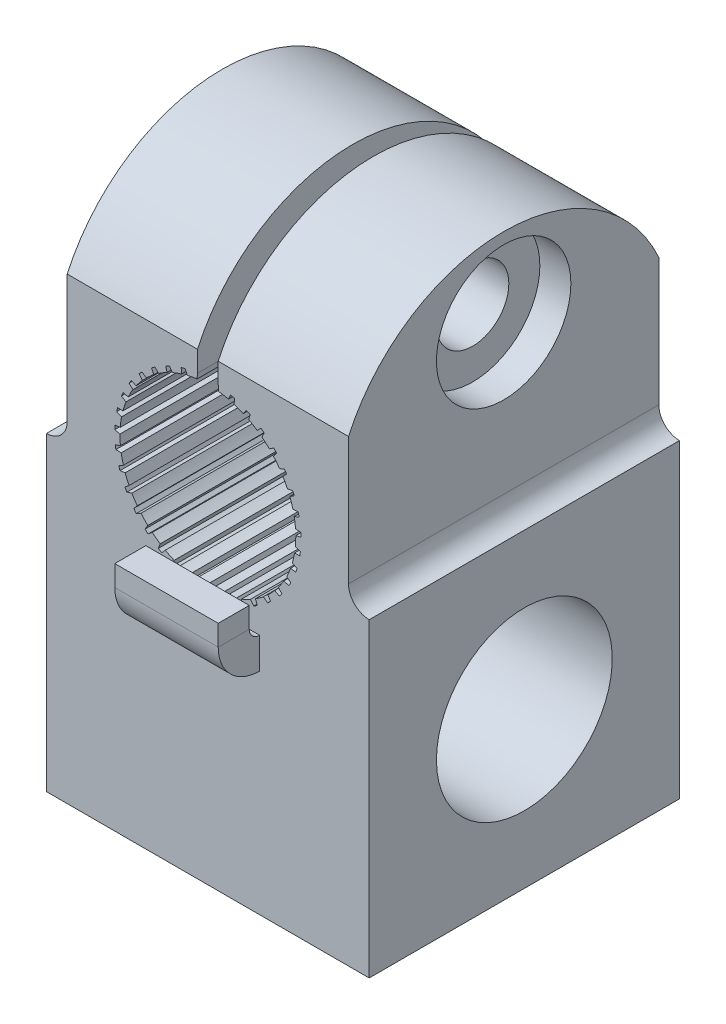
from build123d import *

# Parameters (mm, degrees)
MAIN_BODY_DEPTH     = 7.5
SCREW_DEPTH         = 32.597626493
SCREW_DEPTH_BACK    = 32.597626493
SCHIZZO2_R          = 1.75
SCHIZZO5_R          = 3.25
SCHIZZO5_R_2        = 1.75
WASHER_RECESS_DEPTH = 1.5
NUT_RECESS_DEPTH    = 2.4
CURVE_CUT_DEPTH     = 32.597626493
SCHIZZO7_R          = 4.25
BAR_HOLE_DEPTH      = 33.071950362
RELIEF_1_R          = 1
RELIEF_2_R          = 1
SCHIZZO8_W          = 5
SCHIZZO8_H          = 1.5


with BuildPart() as part:
    # Schizzo1 → Main body (new, symmetric)
    with BuildSketch(Plane.XY):
        with BuildLine():
            Line((-7.8, 0), (-7.8, 15))
            Line((-7.8, 15), (-6.8, 15))
            Line((-6.8, 15), (-6.8, 27))
            Line((-6.8, 27), (-0.5, 27))
            Line((-0.5, 27), (-0.5, 21.172135955))
            Line((-0.5, 21.172135955), (-0.521058877, 20.917937606))
            ThreePointArc((-0.521058877, 20.917937606), (-0.757295619, 20.881985575), (-0.991138348, 20.832813179))
            Line((-0.991138348, 20.832813179), (-1.1, 21.063484846))
            ThreePointArc((-1.1, 21.063484846), (-1.195535928, 21.038282361), (-1.290495504, 21.010988443))
            Line((-1.290495504, 21.010988443), (-1.265827088, 20.757114958))
            ThreePointArc((-1.265827088, 20.757114958), (-1.491847925, 20.679558992), (-1.713152635, 20.589422586))
            Line((-1.713152635, 20.589422586), (-1.861452852, 20.796949265))
            ThreePointArc((-1.861452852, 20.796949265), (-1.950953401, 20.755093196), (-2.03951342, 20.711282215))
            Line((-2.03951342, 20.711282215), (-1.969910575, 20.465893297))
            ThreePointArc((-1.969910575, 20.465893297), (-2.178451011, 20.349226109), (-2.380104787, 20.22102275))
            Line((-2.380104787, 20.22102275), (-2.563077078, 20.398734364))
            ThreePointArc((-2.563077078, 20.398734364), (-2.643665627, 20.341569999), (-2.722979697, 20.282650077))
            Line((-2.722979697, 20.282650077), (-2.610679515, 20.053632728))
            ThreePointArc((-2.610679515, 20.053632728), (-2.795036889, 19.901604096), (-2.970558412, 19.739454346))
            Line((-2.970558412, 19.739454346), (-3.182321897, 19.881639097))
            ThreePointArc((-3.182321897, 19.881639097), (-3.251408264, 19.811003745), (-3.318927165, 19.738868617))
            Line((-3.318927165, 19.738868617), (-3.167539067, 19.533583643))
            ThreePointArc((-3.167539067, 19.533583643), (-3.321787982, 19.351079893), (-3.465535846, 19.160195378))
            Line((-3.465535846, 19.160195378), (-3.699284273, 19.262283331))
            ThreePointArc((-3.699284273, 19.262283331), (-3.754647964, 19.180447272), (-3.808201584, 19.097415419))
            Line((-3.808201584, 19.097415419), (-3.622591307, 18.922460848))
            ThreePointArc((-3.622591307, 18.922460848), (-3.741774077, 18.715347801), (-3.849128107, 18.501863706))
            Line((-3.849128107, 18.501863706), (-4.097348608, 18.560573671))
            ThreePointArc((-4.097348608, 18.560573671), (-4.137210189, 18.470167182), (-4.175077271, 18.378907317))
            Line((-4.175077271, 18.378907317), (-3.961210482, 18.239906333))
            ThreePointArc((-3.961210482, 18.239906333), (-4.041496473, 18.014840773), (-4.109006223, 17.785618653))
            Line((-4.109006223, 17.785618653), (-4.363720787, 17.799063643))
            ThreePointArc((-4.363720787, 17.799063643), (-4.386799074, 17.702992463), (-4.407762539, 17.606437753))
            Line((-4.407762539, 17.606437753), (-4.172513093, 17.507857961))
            ThreePointArc((-4.172513093, 17.507857961), (-4.211321848, 17.27207368), (-4.236817498, 17.034480923))
            Line((-4.236817498, 17.034480923), (-4.48983939, 17.002228804))
            ThreePointArc((-4.48983939, 17.002228804), (-4.495392628, 16.903580741), (-4.498778692, 16.804834534))
            Line((-4.498778692, 16.804834534), (-4.2497077, 16.74984437))
            ThreePointArc((-4.2497077, 16.74984437), (-4.245791873, 16.510919669), (-4.228453973, 16.2725927))
            Line((-4.228453973, 16.2725927), (-4.471650861, 16.195680083))
            ThreePointArc((-4.471650861, 16.195680083), (-4.459500564, 16.097625766), (-4.445200396, 15.999861846))
            Line((-4.445200396, 15.999861846), (-4.190313205, 15.990228739))
            ThreePointArc((-4.190313205, 15.990228739), (-4.143798654, 15.755842854), (-4.084184458, 15.5244417))
            Line((-4.084184458, 15.5244417), (-4.309739794, 15.405340619))
            ThreePointArc((-4.309739794, 15.405340619), (-4.280276483, 15.311031595), (-4.248749703, 15.217392174))
            Line((-4.248749703, 15.217392174), (-3.996238596, 15.253425741))
            ThreePointArc((-3.996238596, 15.253425741), (-3.908620337, 15.031112028), (-3.808645894, 14.814074111))
            Line((-3.808645894, 14.814074111), (-4.009310143, 14.656612573))
            ThreePointArc((-4.009310143, 14.656612573), (-3.963480793, 14.569080011), (-3.915740697, 14.482574738))
            Line((-3.915740697, 14.482574738), (-3.67372159, 14.56311683))
            ThreePointArc((-3.67372159, 14.56311683), (-3.547815746, 14.360020634), (-3.410694317, 14.164321732))
            Line((-3.410694317, 14.164321732), (-3.580017966, 13.973560681))
            ThreePointArc((-3.580017966, 13.973560681), (-3.51929557, 13.895617948), (-3.456876564, 13.819027175))
            Line((-3.456876564, 13.819027175), (-3.233128149, 13.941489103))
            ThreePointArc((-3.233128149, 13.941489103), (-3.072981438, 13.764138102), (-2.903120218, 13.596068139))
            Line((-2.903120218, 13.596068139), (-3.035661066, 13.378138791))
            ThreePointArc((-3.035661066, 13.378138791), (-2.961997291, 13.312291033), (-2.886905574, 13.248076448))
            Line((-2.886905574, 13.248076448), (-2.68861931, 13.408522185))
            ThreePointArc((-2.68861931, 13.408522185), (-2.499378978, 13.262616587), (-2.302237447, 13.127577469))
            Line((-2.302237447, 13.127577469), (-2.393735521, 12.889484253))
            ThreePointArc((-2.393735521, 12.889484253), (-2.309497983, 12.837847871), (-2.224147063, 12.788073385))
            Line((-2.224147063, 12.788073385), (-2.057696033, 12.981346072))
            ThreePointArc((-2.057696033, 12.981346072), (-1.845444421, 12.871575404), (-1.62735887, 12.773907399))
            Line((-1.62735887, 12.773907399), (-1.674873347, 12.523302827))
            ThreePointArc((-1.674873347, 12.523302827), (-1.582769509, 12.487537456), (-1.489902636, 12.453802862))
            Line((-1.489902636, 12.453802862), (-1.360636713, 12.673690557))
            ThreePointArc((-1.360636713, 12.673690557), (-1.132195762, 12.603582937), (-0.90017564, 12.546425176))
            Line((-0.90017564, 12.546425176), (-0.902179366, 12.291363885))
            ThreePointArc((-0.902179366, 12.291363885), (-0.80516952, 12.272619054), (-0.707771512, 12.256008609))
            Line((-0.707771512, 12.256008609), (-0.61984541, 12.495443939))
            ThreePointArc((-0.61984541, 12.495443939), (-0.3825574, 12.467252685), (-0.144060024, 12.452442265))
            Line((-0.144060024, 12.452442265), (-0.100488597, 12.201122135))
            ThreePointArc((-0.100488597, 12.201122135), (-0.001690721, 12.200000318), (0.097107971, 12.201047895))
            Line((0.097107971, 12.201047895), (0.140868235, 12.452335213))
            ThreePointArc((0.140868235, 12.452335213), (0.379376672, 12.466966414), (0.616685799, 12.494979355))
            Line((0.616685799, 12.494979355), (0.704431957, 12.255478021))
            ThreePointArc((0.704431957, 12.255478021), (0.80184242, 12.272015274), (0.898866323, 12.290687204))
            Line((0.898866323, 12.290687204), (0.897054259, 12.545749929))
            ThreePointArc((0.897054259, 12.545749929), (1.129117266, 12.602733326), (1.357610834, 12.672669268))
            Line((1.357610834, 12.672669268), (1.486711489, 12.452684501))
            ThreePointArc((1.486711489, 12.452684501), (1.579603685, 12.486349303), (1.671734373, 12.522045454))
            Line((1.671734373, 12.522045454), (1.624408221, 12.772685659))
            ThreePointArc((1.624408221, 12.772685659), (1.842567101, 12.87018976), (2.054901139, 12.979800905))
            Line((2.054901139, 12.979800905), (2.221206891, 12.786403196))
            ThreePointArc((2.221206891, 12.786403196), (2.306595188, 12.836113532), (2.390871504, 12.887686601))
            Line((2.390871504, 12.887686601), (2.299552366, 13.125848504))
            ThreePointArc((2.299552366, 13.125848504), (2.496795314, 13.260739446), (2.686145231, 13.406502801))
            Line((2.686145231, 13.406502801), (2.884310875, 13.245908111))
            ThreePointArc((2.884310875, 13.245908111), (2.959450824, 13.310066251), (3.033164058, 13.375858637))
            Line((3.033164058, 13.375858637), (2.900787006, 13.593887519))
            ThreePointArc((2.900787006, 13.593887519), (3.070774471, 13.761829796), (3.231054405, 13.939060407))
            Line((3.231054405, 13.939060407), (3.454710735, 13.816430383))
            ThreePointArc((3.454710735, 13.816430383), (3.517187276, 13.892974231), (3.577968223, 13.970871312))
            Line((3.577968223, 13.970871312), (3.408787965, 14.161759545))
            ThreePointArc((3.408787965, 14.161759545), (3.54605641, 14.357355354), (3.672114831, 14.560356884))
            Line((3.672114831, 14.560356884), (3.914073349, 14.479632954))
            ThreePointArc((3.914073349, 14.479632954), (3.961878434, 14.566102328), (4.007773546, 14.653600429))
            Line((4.007773546, 14.653600429), (3.807227674, 14.811212707))
            ThreePointArc((3.807227674, 14.811212707), (3.907365178, 15.028175439), (3.995150466, 15.250423251))
            Line((3.995150466, 15.250423251), (4.247634425, 15.214199949))
            ThreePointArc((4.247634425, 15.214199949), (4.27923156, 15.307815652), (4.308765729, 15.402102511))
            Line((4.308765729, 15.402102511), (4.083299953, 15.521373048))
            ThreePointArc((4.083299953, 15.521373048), (4.143088015, 15.75272934), (4.189778678, 15.987080207))
            Line((4.189778678, 15.987080207), (4.444673036, 15.99652178))
            ThreePointArc((4.444673036, 15.99652178), (4.459046662, 16.094274927), (4.471270637, 16.192320087))
            Line((4.471270637, 16.192320087), (4.228131612, 16.269415428))
            ThreePointArc((4.228131612, 16.269415428), (4.245648593, 16.5077293), (4.249743955, 16.746650992))
            Line((4.249743955, 16.746650992), (4.498856198, 16.80145398))
            ThreePointArc((4.498856198, 16.80145398), (4.495544336, 16.900202704), (4.490065227, 16.998854912))
            Line((4.490065227, 16.998854912), (4.237067641, 17.03129715))
            ThreePointArc((4.237067641, 17.03129715), (4.211750533, 17.268908999), (4.173118965, 17.504722375))
            Line((4.173118965, 17.504722375), (4.40844242, 17.603125366))
            ThreePointArc((4.40844242, 17.603125366), (4.387551516, 17.699695801), (4.364545426, 17.795784295))
            Line((4.364545426, 17.795784295), (4.109820831, 17.78253071))
            ThreePointArc((4.109820831, 17.78253071), (4.042483345, 18.011803494), (3.962366498, 18.23692932))
            Line((3.962366498, 18.23692932), (4.176337676, 18.375769559))
            ThreePointArc((4.176337676, 18.375769559), (4.13853918, 18.467057853), (4.098745545, 18.557494269))
            Line((4.098745545, 18.557494269), (3.850480997, 18.498970842))
            ThreePointArc((3.850480997, 18.498970842), (3.743287416, 18.712535546), (3.624260312, 18.919738091))
            Line((3.624260312, 18.919738091), (3.810002003, 19.09455314))
            ThreePointArc((3.810002003, 19.09455314), (3.75651079, 19.177625211), (3.701208609, 19.259502849))
            Line((3.701208609, 19.259502849), (3.467383536, 19.157590571))
            ThreePointArc((3.467383536, 19.157590571), (3.323779149, 19.348583049), (3.169667416, 19.531202654))
            Line((3.169667416, 19.531202654), (3.32120973, 19.736373813))
            ThreePointArc((3.32120973, 19.736373813), (3.253745052, 19.808559657), (3.184711783, 19.879246902))
            Line((3.184711783, 19.879246902), (2.972841515, 19.737221316))
            ThreePointArc((2.972841515, 19.737221316), (2.797441886, 19.899502913), (2.613198803, 20.051670034))
            Line((2.613198803, 20.051670034), (2.725671044, 20.280602933))
            ThreePointArc((2.725671044, 20.280602933), (2.646401271, 20.339582437), (2.565855699, 20.396807343))
            Line((2.565855699, 20.396807343), (2.382749922, 20.21923327))
            ThreePointArc((2.382749922, 20.21923327), (2.181192539, 20.347588122), (1.972739829, 20.464411982))
            Line((1.972739829, 20.464411982), (2.042527048, 20.709748528))
            ThreePointArc((2.042527048, 20.709748528), (1.953999975, 20.753626043), (1.864530903, 20.795549354))
            Line((1.864530903, 20.795549354), (1.716074786, 20.588134171))
            ThreePointArc((1.716074786, 20.588134171), (1.494837869, 20.678436847), (1.268875374, 20.75616263))
            Line((1.268875374, 20.75616263), (1.293734551, 21.010017507))
            ThreePointArc((1.293734551, 21.010017507), (1.198795513, 21.037382773), (1.103278549, 21.062657039))
            Line((1.103278549, 21.062657039), (0.994243594, 20.83206724))
            ThreePointArc((0.994243594, 20.83206724), (0.76043788, 20.881415338), (0.524228221, 20.917544875))
            Line((0.524228221, 20.917544875), (0.503360362, 21.171758977))
            Line((0.503360362, 21.171758977), (0.5, 21.172135955))
            Line((0.5, 21.172135955), (0.5, 27))
            Line((0.5, 27), (6.8, 27))
            Line((6.8, 27), (6.8, 15))
            Line((6.8, 15), (7.8, 15))
            Line((7.8, 15), (7.8, 0))
            Line((7.8, 0), (-7.8, 0))
        make_face()
    extrude(amount=MAIN_BODY_DEPTH, both=True)

    # Schizzo2 → Screw (cut, two sides: drawn at the far end of the back side and taken through both)
    with BuildSketch(Plane(origin=(6.8, 0, 0), x_dir=(0, 0, -1), z_dir=(1, 0, 0)).offset(-SCREW_DEPTH_BACK)):
        with Locations((0, 23.2)):
            Circle(SCHIZZO2_R)
    extrude(amount=SCREW_DEPTH + SCREW_DEPTH_BACK, mode=Mode.SUBTRACT)

    # Schizzo5 → Washer recess (cut)
    with BuildSketch(Plane(origin=(6.8, 0, 0), x_dir=(0, 0, -1), z_dir=(1, 0, 0))):
        with Locations((0, 23.2)):
            Circle(SCHIZZO5_R)
        with Locations((0, 23.2)):
            Circle(SCHIZZO5_R_2, mode=Mode.SUBTRACT)
    extrude(amount=-WASHER_RECESS_DEPTH, mode=Mode.SUBTRACT)

    # Schizzo6 → Nut recess (cut)
    with BuildSketch(Plane.ZY.offset(6.8)):
        Polygon((3.25, 23.2), (1.625, 26.014582562), (-1.625, 26.014582562), (-3.25, 23.2), (-1.625, 20.385417438), (1.625, 20.385417438), align=None)
    extrude(amount=-NUT_RECESS_DEPTH, mode=Mode.SUBTRACT)

    # Schizzo10 → Curve cut (cut, through all)
    with BuildSketch(Plane(origin=(6.8, 0, 0), x_dir=(0, 0, -1), z_dir=(1, 0, 0))):
        with BuildLine():
            ThreePointArc((-7.5, 22.172135955), (-4.45977217, 25.688686284), (0, 27))
            Line((0, 27), (-7.5, 27))
            Line((-7.5, 27), (-7.5, 22.172135955))
        make_face()
        with BuildLine():
            ThreePointArc((0, 27), (4.45977217, 25.688686284), (7.5, 22.172135955))
            Line((7.5, 22.172135955), (7.5, 27))
            Line((7.5, 27), (0, 27))
        make_face()
    extrude(amount=-CURVE_CUT_DEPTH, mode=Mode.SUBTRACT)

    # Schizzo7 → Bar hole (cut, through all)
    with BuildSketch(Plane.ZY.offset(7.8)):
        with Locations((0, 7.5)):
            Circle(SCHIZZO7_R)
    extrude(amount=-BAR_HOLE_DEPTH, mode=Mode.SUBTRACT)

    # Relief 1
    relief_1_edges = [part.edges().sort_by_distance(p)[0] for p in [
        (6.8, 15, 0),
    ]]
    fillet(relief_1_edges, radius=RELIEF_1_R - 0.0001)  # a hair under: the kernel refuses the full size

    # Relief 2
    relief_2_edges = [part.edges().sort_by_distance(p)[0] for p in [
        (-6.8, 15, 0),
    ]]
    fillet(relief_2_edges, radius=RELIEF_2_R - 0.0001)  # a hair under: the kernel refuses the full size

    # Stop Rod: sweep along a path in Schizzo9
    with BuildLine(Plane(origin=(0, 0, 0), x_dir=(0, 0, -1), z_dir=(1, 0, 0))) as stop_rod_path:
        Line((-8.751213339, 13.201205595), (-8.751213339, 12.201205595))
        ThreePointArc((-8.751213339, 12.201205595), (-8.384741437, 11.316464159), (-7.5, 10.949992257))
    # Schizzo8 → Stop Rod (sweep)
    with BuildSketch(Plane.XY.offset(7.5)):
        with Locations((0.001213314, 10.949992257)):
            Rectangle(SCHIZZO8_W, SCHIZZO8_H)
    sweep(path=stop_rod_path.line)


solid = part.part
